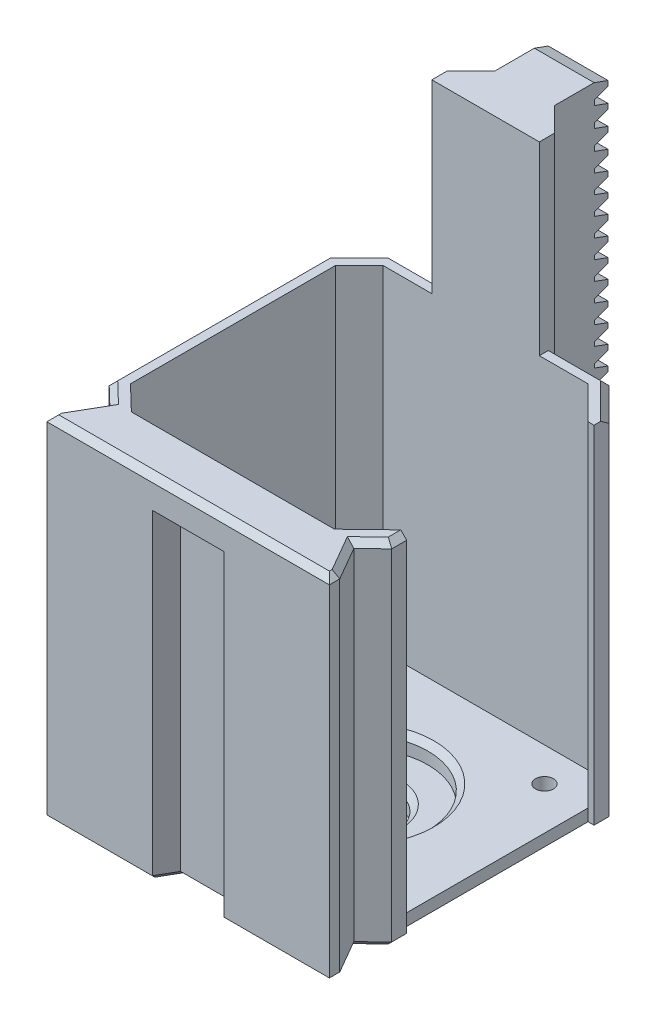
from build123d import *

# Parameters (mm, degrees)
SKETCH1_R                                     = 1.5
SKETCH1_R_2                                   = 11.5
MOUNT_FACE_EXTRUDE_DEPTH                      = 3
BRACKET_MOUNT_HOLE_CHAMFER_SIZE               = 0.75
MAIN_BODY_EXTRUDE_DEPTH                       = 59
FRONT_FACE_FILL_IN_EXTRUDE_DEPTH              = 3
LIMIT_TAB_DEPTH                               = 54
RACK_EXTRUDE_DEPTH                            = 5
RACK_CHAMFER_SIZE                             = 4
RACK_SUPPORT_BASE_EXTRUDE_DEPTH               = 31
FACE_START                                    = 4
SKETCH27_R                                    = 13.6
SKETCH27_R_2                                  = 11.5
SKETCH27_R_3                                  = 6
FACE_COSMETIC_RING_EXTRUDE_DEPTH              = 4
FACE_COSMETIC_RING_MAIN_CHAMFER_SIZE          = 4
FACE_COSMETIC_RING_MAIN_THROUGH_HOLE_CHA_SIZE = 1
FRONT_BACK_FACE_CHAMFER_SIZE                  = 1


with BuildPart() as part:
    # Sketch1 → Mount Face Extrude (new body)
    with BuildSketch(Plane(origin=(0, 0, 0), x_dir=(1, 0, 0), z_dir=(0, 1, 0))):
        Polygon((-21.15, 17.15), (-17.15, 21.15), (17.15, 21.15), (21.15, 17.15), (21.15, -17.15), (17, -21.15), (-17, -21.15), (-21.15, -17.15), align=None)
        with Locations(Location((-15.5, 15.5, 0), (0, 0, 270))):
            Circle(SKETCH1_R, mode=Mode.SUBTRACT)
        with Locations(Location((15.5, 15.5, 0), (0, 0, 270))):
            Circle(SKETCH1_R, mode=Mode.SUBTRACT)
        with Locations(Location((15.5, -15.5, 0), (0, 0, 270))):
            Circle(SKETCH1_R, mode=Mode.SUBTRACT)
        with Locations(Location((-15.5, -15.5, 0), (0, 0, 270))):
            Circle(SKETCH1_R, mode=Mode.SUBTRACT)
        with Locations(Location((0, 0, 0), (0, 0, 270))):
            Circle(SKETCH1_R_2, mode=Mode.SUBTRACT)
    extrude(amount=MOUNT_FACE_EXTRUDE_DEPTH)

    # Bracket Mount Hole Chamfer
    bracket_mount_hole_chamfer_edges = [part.edges().sort_by_distance(p)[0] for p in [
        (-15.5, 0, -17),
        (15.5, 0, -17),
        (15.5, 0, 14),
        (-15.5, 0, 14),
    ]]
    chamfer(bracket_mount_hole_chamfer_edges, length=BRACKET_MOUNT_HOLE_CHAMFER_SIZE)

    # Sketch5 → Main Body Extrude (add)
    with BuildSketch(Plane(origin=(0, 0, 0), x_dir=(1, 0, 0), z_dir=(0, 1, 0))):
        Polygon((21.15, -17.15), (22.65, -15.704216867), (23.65, -15.704216867), (23.65, -18.212588103), (20.420896185, -21.324977322), (23.65, -26.917949192), (23.65, -28.65), (-23.65, -28.65), (-23.65, -26.917949192), (-20.420896185, -21.324977322), (-23.65, -18.212588103), (-23.65, 14.65), (-23.65, 18.185533906), (-18.185533906, 23.65), (18.185533906, 23.65), (23.65, 18.185533906), (23.65, 15.65), (22.65, 15.65), (21.15, 17.15), (17.15, 21.15), (-17.15, 21.15), (-21.15, 17.15), (-21.15, -17.15), (-17, -21.15), (17, -21.15), align=None)
    extrude(amount=MAIN_BODY_EXTRUDE_DEPTH)

    # Sketch37 → Front Face Fill in Extrude (add)
    with BuildSketch(Plane.XZ):
        Polygon((21.15, -17.15), (22.65, -15.65), (22.65, 15.704216867), (21.15, 17.15), align=None)
    extrude(amount=-FRONT_FACE_FILL_IN_EXTRUDE_DEPTH)

    # Sketch39 → Limit Tab (cut)
    with BuildSketch(Plane.XZ):
        Polygon((-6, 28.65), (-4.267949192, 25.65), (4.267949192, 25.65), (6, 28.65), align=None)
    extrude(amount=-LIMIT_TAB_DEPTH, mode=Mode.SUBTRACT)

    # Sketch13 → Rack Extrude (add, symmetric)
    with BuildSketch(Plane(origin=(0, 0, 0), x_dir=(0, 0, -1), z_dir=(1, 0, 0))):
        Polygon((36.65, 6.9244359), (36.65, 6.08158005), (34.400000137, 5.262647), (34.400000137, 4.6017763), (36.65, 3.78284325), (36.65, 2.9399874), (34.400000137, 2.12105435), (34.400000137, 1.46018365), (36.65, 0.6412506), (36.65, 0), (23.65, 0), (23.65, 90), (34.319590547, 90), (34.400000137, 89.9707333), (36.65, 89.15180025), (36.65, 88.3089444), (34.400000137, 87.49001135), (34.400000137, 86.6471555), (36.65, 85.82822245), (36.65, 84.9853666), (34.400000137, 84.16643355), (34.400000137, 83.3235777), (36.65, 82.50464465), (36.65, 81.6617888), (34.400000137, 80.84285575), (34.400000137, 79.9999999), (36.65, 79.18106685), (36.65, 78.338211), (34.400000137, 77.51927795), (34.400000137, 76.85840725), (36.65, 76.0394742), (36.65, 75.19661835), (34.400000137, 74.3776853), (34.400000137, 73.7168146), (36.65, 72.89788155), (36.65, 72.0550257), (34.400000137, 71.23609265), (34.400000137, 70.57522195), (36.65, 69.7562889), (36.65, 68.91343305), (34.400000137, 68.0945), (34.400000137, 67.4336293), (36.65, 66.61469625), (36.65, 65.7718404), (34.400000137, 64.95290735), (34.400000137, 64.29203665), (36.65, 63.4731036), (36.65, 62.63024775), (34.400000137, 61.8113147), (34.400000137, 61.150444), (36.65, 60.33151095), (36.65, 59.4886551), (34.400000137, 58.66972205), (34.400000137, 58.00885135), (36.65, 57.1899183), (36.65, 56.34706245), (34.400000137, 55.5281294), (34.400000137, 54.8672587), (36.65, 54.04832565), (36.65, 53.2054698), (34.400000137, 52.38653675), (34.400000137, 51.72566605), (36.65, 50.906733), (36.65, 50.06387715), (34.400000137, 49.2449441), (34.400000137, 48.5840734), (36.65, 47.76514035), (36.65, 46.9222845), (34.400000137, 46.10335145), (34.400000137, 45.44248075), (36.65, 44.6235477), (36.65, 43.78069185), (34.400000137, 42.9617588), (34.400000137, 42.3008881), (36.65, 41.48195505), (36.65, 40.6390992), (34.400000137, 39.82016615), (34.400000137, 39.15929545), (36.65, 38.3403624), (36.65, 37.49750655), (34.400000137, 36.6785735), (34.400000137, 36.0177028), (36.65, 35.19876975), (36.65, 34.3559139), (34.400000137, 33.53698085), (34.400000137, 32.87611015), (36.65, 32.0571771), (36.65, 31.21432125), (34.400000137, 30.3953882), (34.400000137, 29.7345175), (36.65, 28.91558445), (36.65, 28.0727286), (34.400000137, 27.25379555), (34.400000137, 26.59292485), (36.65, 25.7739918), (36.65, 24.93113595), (34.400000137, 24.1122029), (34.400000137, 23.4513322), (36.65, 22.63239915), (36.65, 21.7895433), (34.400000137, 20.97061025), (34.400000137, 20.30973955), (36.65, 19.4908065), (36.65, 18.64795065), (34.400000137, 17.8290176), (34.400000137, 17.1681469), (36.65, 16.34921385), (36.65, 15.506358), (34.400000137, 14.68742495), (34.400000137, 14.02655425), (36.65, 13.2076212), (36.65, 12.36476535), (34.400000137, 11.5458323), (34.400000137, 10.8849616), (36.65, 10.06602855), (36.65, 9.2231727), (34.400000137, 8.40423965), (34.400000137, 7.74336895), align=None)
    extrude(amount=RACK_EXTRUDE_DEPTH, both=True)

    # Rack Chamfer
    rack_chamfer_edges = [part.edges().sort_by_distance(p)[0] for p in [
        (-5, 29.5, -23.65),
        (5, 29.5, -23.65),
    ]]
    chamfer(rack_chamfer_edges, length=RACK_CHAMFER_SIZE)

    # Sketch15 → Rack Support Base Extrude (add)
    with BuildSketch(Plane(origin=(0, 59, 0), x_dir=(1, 0, 0), z_dir=(0, 1, 0))):
        Polygon((-5, 27.65), (-9, 23.65), (-9, 21.15), (9, 21.15), (9, 23.65), (5, 27.65), align=None)
    extrude(amount=RACK_SUPPORT_BASE_EXTRUDE_DEPTH)

    # Sketch27 → Face Cosmetic Ring Extrude (add)
    # profile 1 of 2: a face of its own
    with BuildSketch(Plane(origin=(0, 0, 0), x_dir=(-1, 0, 0), z_dir=(0, -1, 0)).offset(FACE_START)):
        with Locations(Location((0, 0, 0), (0, 0, 90))):
            Circle(SKETCH27_R)
        with Locations(Location((0, 0, 0), (0, 0, 270))):
            Circle(SKETCH27_R_2, mode=Mode.SUBTRACT)
    # profile 2 of 2: a face of its own
    with BuildSketch(Plane(origin=(0, 0, 0), x_dir=(-1, 0, 0), z_dir=(0, -1, 0)).offset(FACE_START)):
        with Locations(Location((0, 0, 0), (0, 0, 270))):
            Circle(SKETCH27_R_2)
        with Locations(Location((0, 0, 0), (0, 0, 90))):
            Circle(SKETCH27_R_3, mode=Mode.SUBTRACT)
    extrude(amount=-FACE_COSMETIC_RING_EXTRUDE_DEPTH)

    # Face Cosmetic Ring Main Chamfer
    face_cosmetic_ring_main_chamfer_edges = [part.edges().sort_by_distance(p)[0] for p in [
        (0, 0, 13.6),
    ]]
    chamfer(face_cosmetic_ring_main_chamfer_edges, length=FACE_COSMETIC_RING_MAIN_CHAMFER_SIZE - 0.0001)  # a hair under: the kernel refuses the full size

    # Face Cosmetic Ring Main Through Hole Chamfer
    face_cosmetic_ring_main_through_hole_cha_edges = [part.edges().sort_by_distance(p)[0] for p in [
        (0, 3, -11.5),
        (0, 0, 6),
        (0, -4, 6),
    ]]
    chamfer(face_cosmetic_ring_main_through_hole_cha_edges, length=FACE_COSMETIC_RING_MAIN_THROUGH_HOLE_CHA_SIZE)

    # Front/Back Face Chamfer
    front_back_face_chamfer_edges = [part.edges().sort_by_distance(p)[0] for p in [
        (22.65, 0, 0.027108434),
        (-20.917766953, 59, -20.917766953),
        (-23.65, 59, 0.013527099),
        (-22.035448093, 59, 19.768782713),
        (-22.035448093, 59, 24.121463257),
        (-23.65, 59, 27.783974596),
        (0, 59, 28.65),
        (23.65, 59, 27.783974596),
        (22.035448093, 59, 24.121463257),
        (22.035448093, 59, 19.768782713),
        (23.65, 59, 16.958402485),
        (-13.592766953, 59, -23.65),
        (20.917766953, 59, -20.917766953),
        (13.592766953, 59, -23.65),
        (23.15, 0, -15.65),
        (23.15, 0, 15.704216867),
        (-13.592766953, 0, -23.65),
        (-7, 0, -25.65),
        (-20.917766953, 0, -20.917766953),
        (-23.65, 0, 0.013527099),
        (-22.035448093, 0, 19.768782713),
        (-22.035448093, 0, 24.121463257),
        (7, 0, -25.65),
        (-23.65, 0, 27.783974596),
        (13.592766953, 0, -23.65),
        (-14.825, 0, 28.65),
        (20.917766953, 0, -20.917766953),
        (-5.133974596, 0, 27.15),
        (23.65, 0, -16.917766953),
        (0, 0, 25.65),
        (5.133974596, 0, 27.15),
        (14.825, 0, 28.65),
        (23.65, 0, 27.783974596),
        (23.65, 0, 16.958402485),
        (22.035448093, 0, 24.121463257),
        (22.035448093, 0, 19.768782713),
    ]]
    chamfer(front_back_face_chamfer_edges, length=FRONT_BACK_FACE_CHAMFER_SIZE)


solid = part.part
